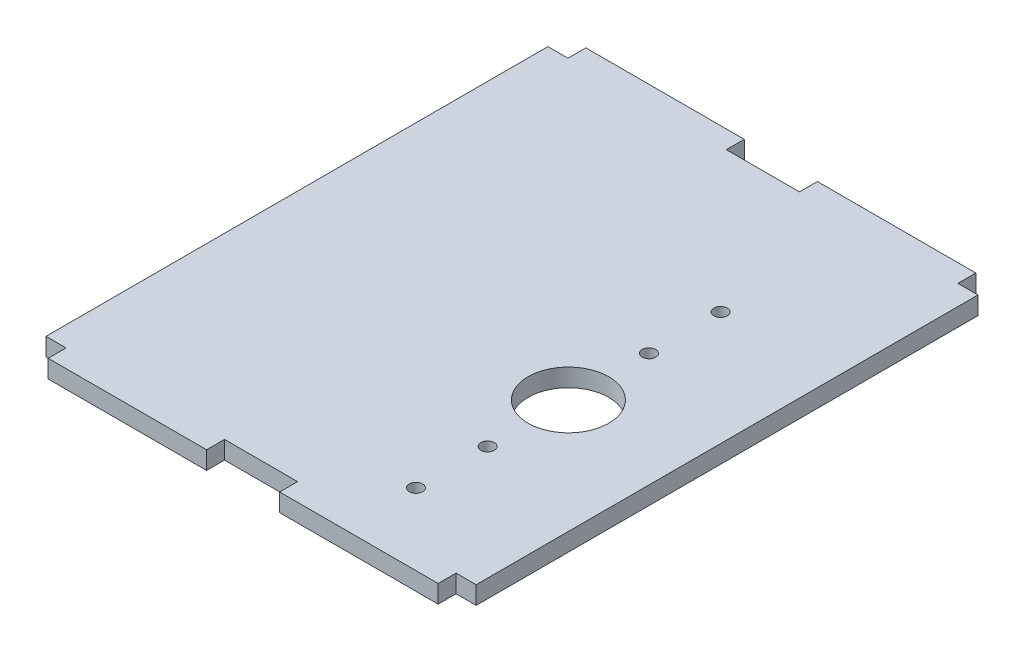
from build123d import *

# Parameters (mm, degrees)
SKETCH1_W           = 304.8
SKETCH1_H           = 355.6
BOSS_EXTRUDE1_DEPTH = 12.7
SKETCH2_R           = 4.7625
CUT_EXTRUDE1_DEPTH  = 12.7
SKETCH3_W           = 112.268
SKETCH3_H           = 12.7
BOSS_EXTRUDE2_DEPTH = 12.7
SKETCH4_R           = 28.575
CUT_EXTRUDE2_DEPTH  = 12.7


with BuildPart() as part:
    # Sketch1 → Boss-Extrude1 (new body)
    with BuildSketch(Plane(origin=(0, 0, 0), x_dir=(1, 0, 0), z_dir=(0, 1, 0))):
        with Locations((152.4, 177.8)):
            Rectangle(SKETCH1_W, SKETCH1_H)
    extrude(amount=BOSS_EXTRUDE1_DEPTH)

    # Sketch2 → Cut-Extrude1 (cut)
    with BuildSketch(Plane.XZ):
        with Locations((224.028, -38.1)):
            Circle(SKETCH2_R)
        with Locations((224.028, -88.9)):
            Circle(SKETCH2_R)
        with Locations((224.028, -203.2)):
            Circle(SKETCH2_R)
        with Locations((224.028, -254)):
            Circle(SKETCH2_R)
    extrude(amount=-CUT_EXTRUDE1_DEPTH, mode=Mode.SUBTRACT)

    # Sketch3 → Boss-Extrude2 (add)
    with BuildSketch(Plane(origin=(0, 12.7, 0), x_dir=(1, 0, 0), z_dir=(0, 1, 0))):
        with Locations((70.358, 361.95)):
            Rectangle(SKETCH3_W, SKETCH3_H)
        with Locations((234.442, 361.95)):
            Rectangle(SKETCH3_W, SKETCH3_H)
        with Locations((234.442, -6.35)):
            Rectangle(SKETCH3_W, SKETCH3_H)
        with Locations((70.358, -6.35)):
            Rectangle(SKETCH3_W, SKETCH3_H)
    extrude(amount=-BOSS_EXTRUDE2_DEPTH)

    # Sketch4 → Cut-Extrude2 (cut)
    with BuildSketch(Plane.XZ):
        with Locations((224.11748604, -146.05)):
            Circle(SKETCH4_R)
    extrude(amount=-CUT_EXTRUDE2_DEPTH, mode=Mode.SUBTRACT)


solid = part.part
